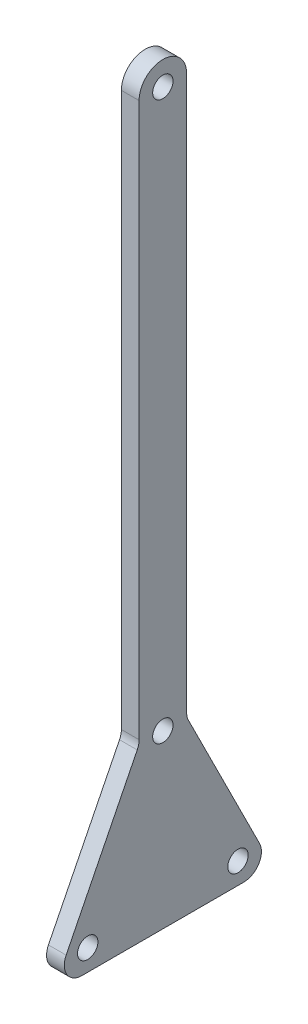
from build123d import *

# Parameters (mm, degrees)
SKETCH1_R           = 1.8288
BOSS_EXTRUDE1_DEPTH = 3.175
FILLET1_R           = 3.175


with BuildPart() as part:
    # Sketch1 → Boss-Extrude1 (new body)
    with BuildSketch(Plane(origin=(0, 0, 0), x_dir=(0, 0, -1), z_dir=(1, 0, 0))):
        with BuildLine():
            Line((-19.639409497, -3.81), (19.639409497, -3.81))
            Line((19.639409497, -3.81), (4.259709497, 26.9494))
            Line((4.259709497, 26.9494), (4.259709497, 126.9494))
            ThreePointArc((4.259709497, 126.9494), (0, 131.209109497), (-4.259709497, 126.9494))
            Line((-4.259709497, 126.9494), (-4.259709497, 26.9494))
            Line((-4.259709497, 26.9494), (-19.639409497, -3.81))
        make_face()
        with Locations((-13.4747, 0)):
            Circle(SKETCH1_R, mode=Mode.SUBTRACT)
        with Locations((13.4747, 0)):
            Circle(SKETCH1_R, mode=Mode.SUBTRACT)
        with Locations((0, 26.9494)):
            Circle(SKETCH1_R, mode=Mode.SUBTRACT)
        with Locations((0, 126.9494)):
            Circle(SKETCH1_R, mode=Mode.SUBTRACT)
    extrude(amount=BOSS_EXTRUDE1_DEPTH)

    # Fillet1
    fillet1_edges = [part.edges().sort_by_distance(p)[0] for p in [
        (1.5875, -3.81, -19.639409497),
        (1.5875, -3.81, 19.639409497),
        (1.5875, 26.9494, 4.259709497),
        (1.5875, 26.9494, -4.259709497),
    ]]
    fillet(fillet1_edges, radius=FILLET1_R)


solid = part.part
